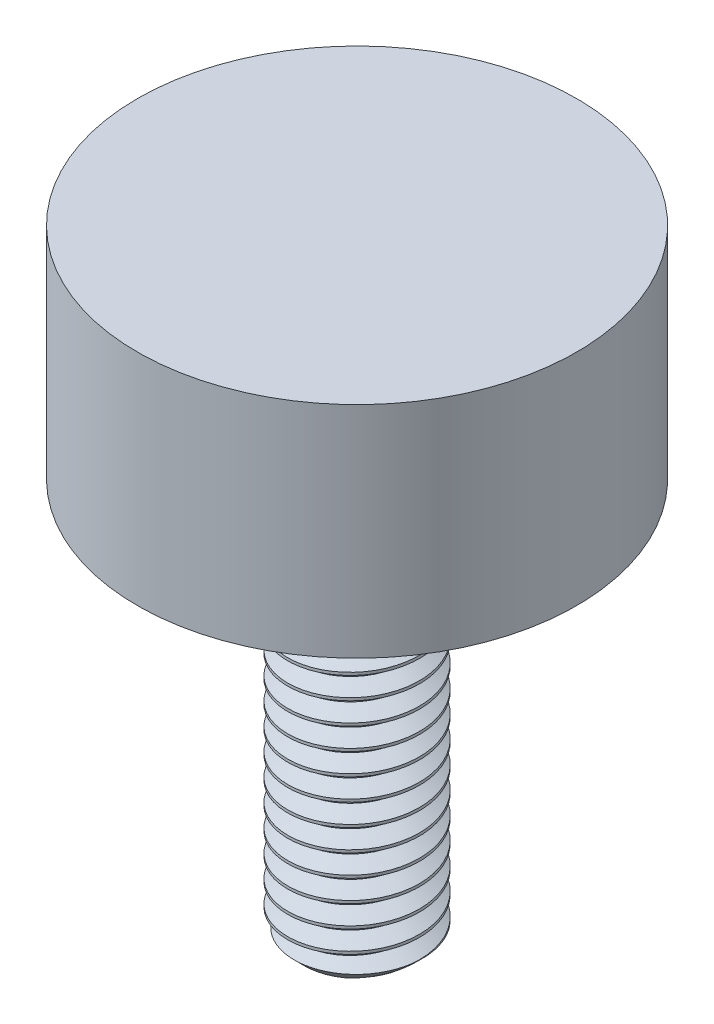
from build123d import *

# Parameters (mm, degrees)
CUT_SWEEP1_PITCH = 1


with BuildPart() as part:
    # Sketch2 → Revolve1 (revolve)
    with BuildSketch(Plane.XY):
        Polygon((-10, 4), (-8, 4), (-8, 4.2), (-3.15, 4.2), (-3.15, 9.1), (0, 9.1), (0, 14), (-10, 14), align=None)
    revolve(axis=Axis((0, 14, 0), (0, -1, 0)))


with BuildPart() as body_2:
    # Sketch3 → Revolve2 (revolve)
    with BuildSketch(Plane.XY):
        Polygon((-8, 4.2), (-3.15, 4.2), (-3.15, 4.1), (-3.15, 4), (-3.25, 4), (-8, 4), align=None)
    revolve(axis=Axis((0, 14, 0), (0, -1, 0)))


with BuildPart() as body_3:
    # Sketch5 → Revolve3 (revolve)
    with BuildSketch(Plane.XY):
        Polygon((-2.4, -14), (0, -14), (0, 9.1), (-3.15, 9.1), (-3.15, 4), (-3, 3.85), (-3, -13.4), align=None)
    revolve(axis=Axis((0, 9.1, 0), (0, -1, 0)))

    # Cut-Sweep1: the profile of Sketch7 screwed along a right-hand helix of 28 turns, 8 arcs to a turn; built about Z, then put on its axis
    cut_sweep1_z = Axis((0, 0, 0), (0, 0, 1))
    cut_sweep1_corners = [(0, 3.108253175, 0.0625), (0, 3, -0.875), (0, 2.350480947, -0.5), (0, 2.350480947, -0.375)]
    with BuildLine(mode=Mode.PRIVATE) as cut_sweep1_profile:
        Line(cut_sweep1_corners[0], cut_sweep1_corners[1])
        Line(cut_sweep1_corners[1], cut_sweep1_corners[2])
        Line(cut_sweep1_corners[2], cut_sweep1_corners[3])
        Line(cut_sweep1_corners[3], cut_sweep1_corners[0])
    cut_sweep1_cap = Face(cut_sweep1_profile.wire())
    cut_sweep1_turn_angles = [0, 22.5, 45, 67.5, 90, 112.5, 135, 157.5, 180, 202.5, 225, 247.5, 270, 292.5, 315, 337.5, 360]
    cut_sweep1_turn_weights = [1, 0.9238795325112867, 1, 0.9238795325112867, 1, 0.9238795325112867, 1, 0.9238795325112867, 1, 0.9238795325112867, 1, 0.9238795325112867, 1, 0.9238795325112867, 1, 0.9238795325112867, 1]
    cut_sweep1_turn_rails = [Edge.make_bspline([Vector(p[0], p[1], 0).rotate(cut_sweep1_z, cut_sweep1_turn_angles[k]) / cut_sweep1_turn_weights[k] + Vector(0, 0, p[2] + CUT_SWEEP1_PITCH * cut_sweep1_turn_angles[k] / 360) for k in range(17)], [0, 0, 0, 1, 1, 2, 2, 3, 3, 4, 4, 5, 5, 6, 6, 7, 7, 8, 8, 8], 2, cut_sweep1_turn_weights) for p in cut_sweep1_corners]
    cut_sweep1_turn_sides = [Face.make_surface_from_curves(cut_sweep1_turn_rails[p[0]], cut_sweep1_turn_rails[p[1]]) for p in [(0, 1), (1, 2), (2, 3), (3, 0)]]
    cut_sweep1 = Plane(origin=(0, -14, 0), x_dir=(0, 0, -1), z_dir=(0, 1, 0)) * Solid(Shell([*[p.moved(Location((0, 0, CUT_SWEEP1_PITCH * i))) for i in range(28) for p in cut_sweep1_turn_sides], cut_sweep1_cap, cut_sweep1_cap.rotate(cut_sweep1_z, 10080).moved(Location((0, 0, CUT_SWEEP1_PITCH * 10080 / 360)))]))
    add(cut_sweep1, mode=Mode.SUBTRACT)

    # Sketch8 → Revolve4 (revolve)
    with BuildSketch(Plane.XY):
        Polygon((-3.15, 9.1), (0, 9.1), (0, 0.85), (-3.15, 4), align=None)
    revolve(axis=Axis((0, 9.1, 0), (0, -1, 0)))


solid = Compound([part.part, body_2.part, body_3.part])
